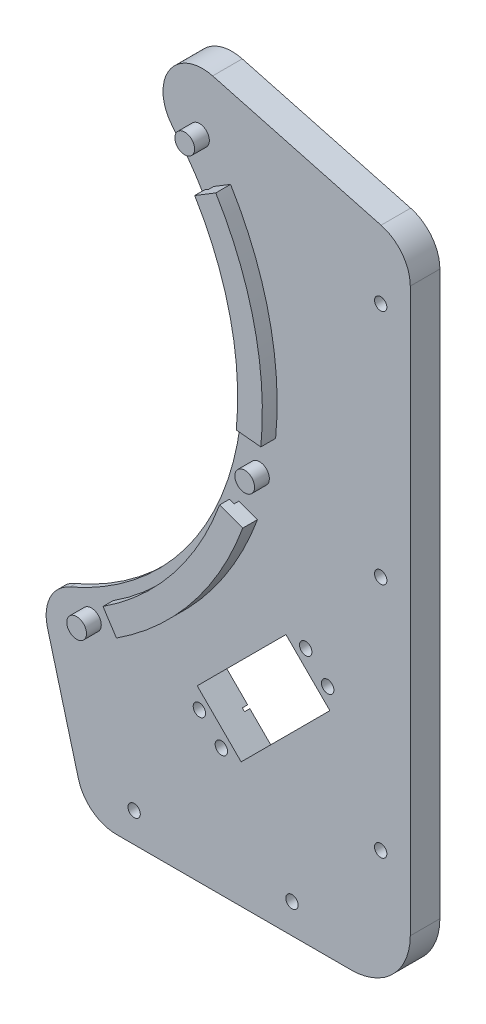
from build123d import *

# Parameters (mm, degrees)
SKETCH1_R             = 3.175
BOSS_EXTRUDE1_DEPTH   = 4.7625
BOSS_EXTRUDE1_2_DEPTH = 4.7625
BOSS_EXTRUDE1_3_DEPTH = 4.7625
BOSS_EXTRUDE1_4_DEPTH = 4.7625
BOSS_EXTRUDE1_5_DEPTH = 4.7625
SKETCH2_R             = 1.984375
BOSS_EXTRUDE2_DEPTH   = 9.525
BOSS_EXTRUDE3_DEPTH   = 3.175
SKETCH5_R             = 2
CUT_EXTRUDE1_DEPTH    = 207.765399971
CUT_EXTRUDE2_DEPTH    = 0.5
CHAMFER1_SIZE         = 7.62
CHAMFER1_SIZE_2       = 9.081162376


with BuildPart() as part:
    # Sketch1 → Boss-Extrude1 (new body)
    with BuildSketch(Plane.XY):
        with Locations(Location((-78.19292114, 62.356773808, 0), (0, 0, 180))):
            Circle(SKETCH1_R)
    extrude(amount=BOSS_EXTRUDE1_DEPTH)



with BuildPart() as body_2:
    # Sketch1 → Boss-Extrude1 2 (new body)
    with BuildSketch(Plane.XY):
        with Locations(Location((-97.504977817, -22.254874907, 0), (0, 0, 180))):
            Circle(SKETCH1_R)
    extrude(amount=BOSS_EXTRUDE1_2_DEPTH)


with BuildPart() as body_3:
    # Sketch1 → Boss-Extrude1 3 (new body)
    with BuildSketch(Plane.XY):
        with Locations(Location((-43.393797458, -90.108148901, 0), (0, 0, 180))):
            Circle(SKETCH1_R)
    extrude(amount=BOSS_EXTRUDE1_3_DEPTH)


with BuildPart() as body_4:
    # Sketch1 → Boss-Extrude1 4 (new body)
    with BuildSketch(Plane.XY):
        with BuildLine():
            Line((-88.191845565, 53.571060584), (-82.764655069, 50.274379933))
            ThreePointArc((-82.764655069, 50.274379933), (-94.409581696, 21.548370942), (-96.381613527, -9.385413164))
            Line((-96.381613527, -9.385413164), (-102.701719332, -10.000850093))
            ThreePointArc((-102.701719332, -10.000850093), (-100.600373938, 22.961378873), (-88.191845565, 53.571060584))
        make_face()
    extrude(amount=BOSS_EXTRUDE1_4_DEPTH)


with BuildPart() as body_5:
    # Sketch1 → Boss-Extrude1 5 (new body)
    with BuildSketch(Plane.XY):
        with BuildLine():
            Line((-90.909011383, -33.362449786), (-96.870258031, -35.550151411))
            ThreePointArc((-96.870258031, -35.550151411), (-80.675236097, -64.336353929), (-56.214495182, -86.53086552))
            Line((-56.214495182, -86.53086552), (-52.755141633, -81.20588918))
            ThreePointArc((-52.755141633, -81.20588918), (-75.710606183, -60.377193687), (-90.909011383, -33.362449786))
        make_face()
    extrude(amount=BOSS_EXTRUDE1_5_DEPTH)


with BuildPart() as part_1:
    add(part.part)

    add(body_2.part)  # Boss-Extrude2 merges body 2

    add(body_3.part)  # Boss-Extrude2 merges body 3
    # Sketch2 → Boss-Extrude2 (add)
    with BuildSketch(Plane.XY):
        with BuildLine():
            Line((-82.430084054, 80.927094637), (-136.637001873, 66.402394783))
            ThreePointArc((-136.637001873, 66.402394783), (-143.425587422, 61.866406938), (-146.05, 54.13513679))
            Line((-146.05, 54.13513679), (-146.05, -127))
            ThreePointArc((-146.05, -127), (-140.470384182, -140.470384182), (-127, -146.05))
            Line((-127, -146.05), (-51.469574148, -146.05))
            ThreePointArc((-51.469574148, -146.05), (-43.738303999, -143.425587422), (-39.202316154, -136.637001873))
            Line((-39.202316154, -136.637001873), (-29.247808511, -99.486273586))
            ThreePointArc((-29.247808511, -99.486273586), (-30.083781104, -90.666124862), (-36.482937232, -84.53875393))
            ThreePointArc((-36.482937232, -84.53875393), (-89.766487514, -20.488614994), (-69.549981311, 60.337432202))
            ThreePointArc((-69.549981311, 60.337432202), (-68.376222335, 75.395171012), (-82.430084054, 80.927094637))
        make_face()
        with Locations((-136.525, 44.45)):
            Circle(SKETCH2_R, mode=Mode.SUBTRACT)
        with Locations((-136.525, -31.75)):
            Circle(SKETCH2_R, mode=Mode.SUBTRACT)
        with Locations((-136.525, -107.95)):
            Circle(SKETCH2_R, mode=Mode.SUBTRACT)
        with Locations((-57.15, -136.525)):
            Circle(SKETCH2_R, mode=Mode.SUBTRACT)
        with Locations((-107.95, -136.525)):
            Circle(SKETCH2_R, mode=Mode.SUBTRACT)
    extrude(amount=-BOSS_EXTRUDE2_DEPTH)


    add(body_4.part)  # Boss-Extrude3 merges body 4

    add(body_5.part)  # Boss-Extrude3 merges body 5
    # Sketch3 → Boss-Extrude3 (add)
    with BuildSketch(Plane.XY.offset(4.7625)):
        with BuildLine():
            Line((-81.407857445, 49.45020977), (-88.191845565, 53.571060584))
            ThreePointArc((-88.191845565, 53.571060584), (-100.600373938, 22.961378873), (-102.701719332, -10.000850093))
            Line((-102.701719332, -10.000850093), (-94.801587075, -9.231553932))
            ThreePointArc((-94.801587075, -9.231553932), (-92.861883635, 21.195118959), (-81.407857445, 49.45020977))
        make_face()
        with BuildLine():
            Line((-96.870258031, -35.550151411), (-89.418699721, -32.815524379))
            ThreePointArc((-89.418699721, -32.815524379), (-74.469448705, -59.387403627), (-51.890303245, -79.874645095))
            Line((-51.890303245, -79.874645095), (-56.214495182, -86.53086552))
            ThreePointArc((-56.214495182, -86.53086552), (-80.675236097, -64.336353929), (-96.870258031, -35.550151411))
        make_face()
    extrude(amount=-BOSS_EXTRUDE3_DEPTH)


with BuildPart() as body_2_2:
    # Mirror2: mirrored copy
    add(part_1.part.mirror(Plane(origin=(0, 0, 0), x_dir=(0, 0, 1), z_dir=(1, 0, 0))))

    # Sketch5 → Cut-Extrude1 (cut, through all)
    with BuildSketch(Plane.XY):
        with Locations((119.458619614, -70.809673068)):
            Circle(SKETCH5_R)
        with Locations((112.387551802, -63.738605256)):
            Circle(SKETCH5_R)
        with Locations((78.163583592, -97.962573466)):
            Circle(SKETCH5_R)
        with Locations((85.234651404, -105.033641277)):
            Circle(SKETCH5_R)
        Polygon((106.023590771, -63.031498475), (77.456476811, -91.598612435), (91.598612435, -105.740748059), (120.165726395, -77.173634099), align=None)
    extrude(amount=-CUT_EXTRUDE1_DEPTH, mode=Mode.SUBTRACT)

    # Sketch6 → Cut-Extrude2 (cut, symmetric)
    with BuildSketch(Plane(origin=(91.598612435, -91.598612435, 0), x_dir=(0, 0, -1), z_dir=(0.7071067811865488, -0.7071067811865462, 0))):
        Polygon((9.525, 30.4), (9.525, 36.9), (7.825, 30.4), align=None)
        Polygon((7.825, -10), (9.525, -10), (9.525, -16.5), align=None)
    extrude(amount=CUT_EXTRUDE2_DEPTH, both=True, mode=Mode.SUBTRACT)

    # Chamfer1
    # the kernel refuses this chamfer: 9.081162376, 7.62 mm, written as the material it takes off along each edge
    with BuildSketch(Plane(origin=(0, 0, -9.525), x_dir=(0.15246082974719, -0.9883095139645264, 0), z_dir=(-0.9883095139645264, -0.15246082974719, 0))) as chamfer1_piece_1:
        Polygon((92.075, CHAMFER1_SIZE), (92.075 + CHAMFER1_SIZE_2, 0), (92.075, 0), align=None)
    revolve(axis=Axis((0, 0, -9.525), (0, 0, 1)), revolution_arc=136.746589735, mode=Mode.SUBTRACT)


solid = body_2_2.part
